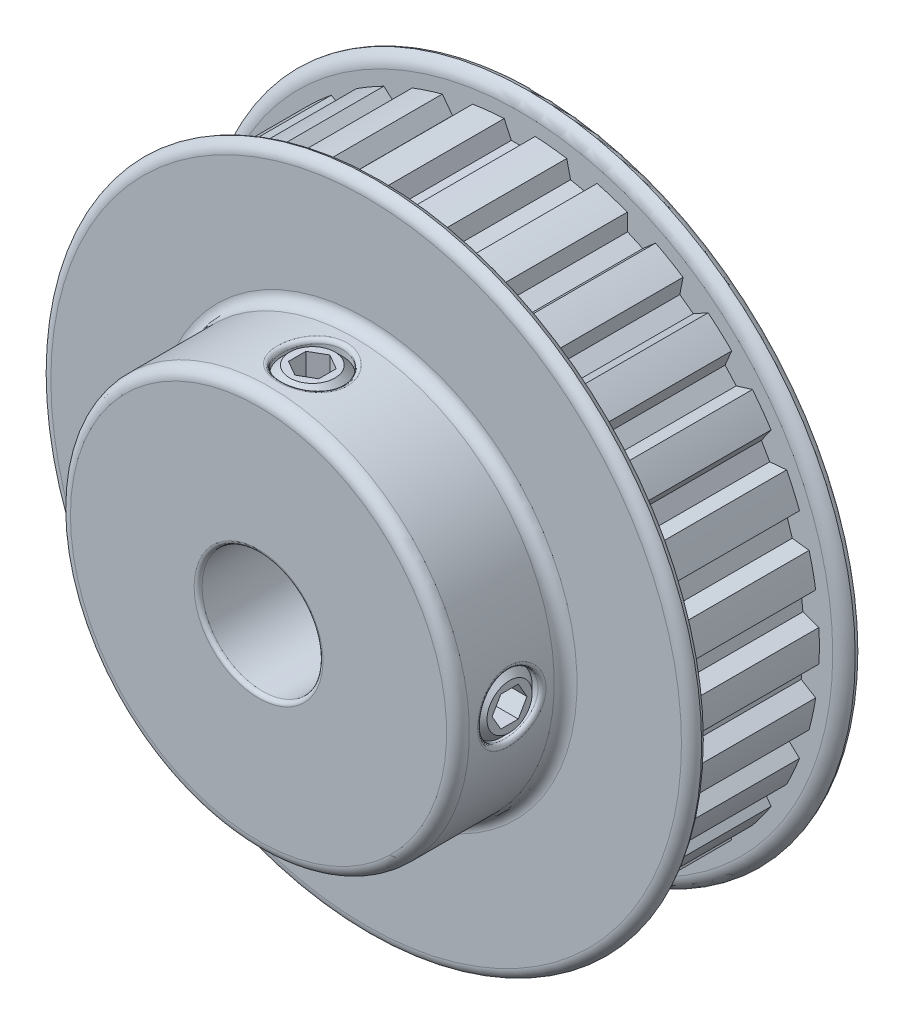
from build123d import *

# Parameters (mm, degrees)
CUT_EXTRUDE1_START = -10.05
CUT_EXTRUDE1_DEPTH = 11.2
CIRPATTERN1_COUNT  = 30
SKETCH4_R          = 2.5
CUT_EXTRUDE2_DEPTH = 40.892386492
CUT_EXTRUDE3_DEPTH = 1.875
CIRPATTERN2_COUNT  = 2
CIRPATTERN2_ANGLE  = 90
FILLET1_R          = 0.942857143
FILLET2_R          = 0.33


with BuildPart() as part:
    # Sketch7 → Revolve1 (revolve)
    with BuildSketch(Plane(origin=(0, 0, 0), x_dir=(0, 0, -1), z_dir=(1, 0, 0)), mode=Mode.PRIVATE) as revolve1_sk:
        with BuildLine():
            Line((-11.55, 5), (-11.55, 16.5))
            Line((-11.55, 16.5), (-2.65, 16.5))
            Line((-2.65, 16.5), (-2.65, 27))
            Line((-2.65, 27), (-1.9, 27))
            ThreePointArc((-1.9, 27), (-1.355113501, 26.560645809), (-1.15, 25.891420993))
            Line((-1.15, 25.891420993), (-1.15, 24.782841987))
            Line((-1.15, 24.782841987), (10.05, 24.782841987))
            Line((10.05, 24.782841987), (10.05, 25.891420993))
            ThreePointArc((10.05, 25.891420993), (10.255113501, 26.560645809), (10.8, 27))
            Line((10.8, 27), (11.55, 27))
            Line((11.55, 27), (11.55, 5))
            Line((11.55, 5), (-11.55, 5))
        make_face()
    revolve(revolve1_sk.sketch.rotate(Axis((0, 0, 11.55), (0, 0, -1)), 90), axis=Axis((0, 0, 11.55), (0, 0, -1)))

    # Sketch3 → Cut-Extrude1 (cut)
    with BuildSketch(Plane.XY.offset(CUT_EXTRUDE1_START)):
        with BuildLine():
            Line((-0.690489274, 23.479625), (0.690489274, 23.479625))
            Line((0.690489274, 23.479625), (1.2827, 24.749625))
            ThreePointArc((1.2827, 24.749625), (0, 24.782841987), (-1.2827, 24.749625))
            Line((-1.2827, 24.749625), (-0.690489274, 23.479625))
        make_face()
    cut_extrude1 = extrude(amount=CUT_EXTRUDE1_DEPTH, mode=Mode.SUBTRACT)

    # CirPattern1: Cut-Extrude1 ×30 about axis
    cirpattern1_axis = Axis((0, 0, 0), (0, 0, 1))
    for i in range(1, CIRPATTERN1_COUNT):
        add(cut_extrude1.rotate(cirpattern1_axis, i * 360 / CIRPATTERN1_COUNT), mode=Mode.SUBTRACT)

    # Sketch4 → Cut-Extrude2 (cut, through all)
    with BuildSketch(Plane(origin=(0, 0, 0), x_dir=(1, 0, 0), z_dir=(0, 1, 0))):
        with Locations(Location((0, -7.1, 0), (0, 0, 90))):
            Circle(SKETCH4_R)
    cut_extrude2 = extrude(amount=CUT_EXTRUDE2_DEPTH, mode=Mode.SUBTRACT)

    # Sketch5 → Revolve2 (revolve)
    with BuildSketch(Plane.XY.offset(7.1), mode=Mode.PRIVATE) as revolve2_sk:
        Polygon((0, 16.30950643), (0, 5), (-1.865, 5), (-2.5, 5.635), (-2.5, 15.67450643), (-1.865, 16.30950643), align=None)
    revolve2 = revolve(revolve2_sk.sketch.rotate(Axis((0, 0, 7.1), (0, 1, 0)), 270), axis=Axis((0, 0, 7.1), (0, 1, 0)))

    # Sketch6 → Cut-Extrude3 (cut)
    with BuildSketch(Plane(origin=(0, 16.30950643, 0), x_dir=(-1, 0, 0), z_dir=(0, -1, 0))):
        Polygon((0, -5.656624327), (-1.25, -6.378312164), (-1.25, -7.821687836), (0, -8.543375673), (1.25, -7.821687836), (1.25, -6.378312164), align=None)
    cut_extrude3 = extrude(amount=CUT_EXTRUDE3_DEPTH, mode=Mode.SUBTRACT)

    # CirPattern2: Cut-Extrude2, Revolve2, Cut-Extrude3 ×2 about axis
    cirpattern2_axis = Axis((0, 0, 0), (0, 0, -1))
    add([cut_extrude2.rotate(cirpattern2_axis, i * CIRPATTERN2_ANGLE / (CIRPATTERN2_COUNT - 1)) for i in range(1, CIRPATTERN2_COUNT)], mode=Mode.SUBTRACT)
    add([revolve2.rotate(cirpattern2_axis, i * CIRPATTERN2_ANGLE / (CIRPATTERN2_COUNT - 1)) for i in range(1, CIRPATTERN2_COUNT)])
    add([cut_extrude3.rotate(cirpattern2_axis, i * CIRPATTERN2_ANGLE / (CIRPATTERN2_COUNT - 1)) for i in range(1, CIRPATTERN2_COUNT)], mode=Mode.SUBTRACT)

    # Fillet1
    # the kernel refuses this fillet: 0.942857143 mm, written as the material it adds along each edge
    with BuildSketch(Plane(origin=(0, 0, 2.65), x_dir=(1, 0, 0), z_dir=(0, 1, 0))) as fillet1_piece_1:
        with BuildLine():
            CenterArc((16.5 + FILLET1_R, -FILLET1_R), FILLET1_R, 90, 90)
            Line((16.5 + FILLET1_R, 0), (16.5, 0))
            Line((16.5, 0), (16.5, -FILLET1_R))
        make_face()
    revolve(axis=Axis((0, 0, 2.65), (0, 0, -1)))
    # the kernel refuses this fillet: 0.942857143 mm, written as the material it takes off along each edge
    with BuildSketch(Plane(origin=(0, 0, -11.55), x_dir=(1, 0, 0), z_dir=(0, 1, 0))) as fillet1_2_piece_1:
        with BuildLine():
            CenterArc((26.077077623, -0.942857143), FILLET1_R, 11.80289169, 78.19710831)
            Line((27, -0.75), (27, 0))
            Line((27, 0), (26.077077623, 0))
        make_face()
    revolve(axis=Axis((0, 0, -11.55), (0, 0, -1)), mode=Mode.SUBTRACT)
    with BuildSketch(Plane(origin=(0, 0, 11.55), x_dir=(1, 0, 0), z_dir=(0, 1, 0))) as fillet1_2_piece_2:
        with BuildLine():
            CenterArc((16.5 - FILLET1_R, FILLET1_R), FILLET1_R, 270, 90)
            Line((16.5, FILLET1_R), (16.5, 0))
            Line((16.5, 0), (16.5 - FILLET1_R, 0))
        make_face()
    revolve(axis=Axis((0, 0, 11.55), (0, 0, -1)), mode=Mode.SUBTRACT)
    with BuildSketch(Plane(origin=(0, 0, 2.65), x_dir=(1, 0, 0), z_dir=(0, 1, 0))) as fillet1_2_piece_3:
        with BuildLine():
            CenterArc((26.077077623, 0.942857143), FILLET1_R, 270, 78.19710831)
            Line((27, 0.75), (27, 0))
            Line((27, 0), (26.077077623, 0))
        make_face()
    revolve(axis=Axis((0, 0, 2.65), (0, 0, -1)), mode=Mode.SUBTRACT)

    # Fillet2
    fillet2_edges = [part.edges().sort_by_distance(p)[0] for p in [
        (-5, 0, -11.55),
        (-1e-09, 16.500000001, 9.600000017),
        (16.30950643, -2.5, 7.1),
        (-5, 0, 11.55),
    ]]
    fillet(fillet2_edges, radius=FILLET2_R)


solid = part.part
